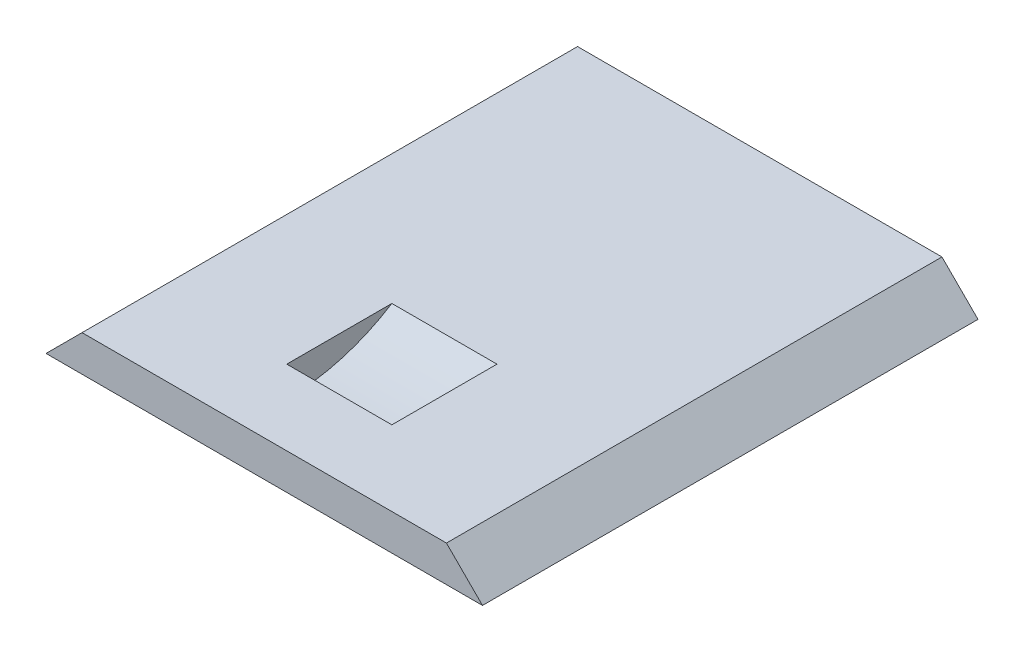
from build123d import *

# Parameters (mm, degrees)
BOSS_EXTRUDE1_DEPTH = 33
SKETCH2_W           = 7
SKETCH2_H           = 7
CUT_EXTRUDE1_DEPTH  = 2
FILLET1_R           = 13


with BuildPart() as part:
    # Sketch1 → Boss-Extrude1 (new body)
    with BuildSketch(Plane.XY):
        Polygon((-12.134314575, 2.8), (-14.534314575, 0.4), (14.534314575, 0.4), (12.134314575, 2.8), align=None)
    extrude(amount=-BOSS_EXTRUDE1_DEPTH)

    # Sketch2 → Cut-Extrude1 (cut)
    with BuildSketch(Plane(origin=(0, 2.8, 0), x_dir=(1, 0, 0), z_dir=(0, 1, 0))):
        with Locations((0, 8.5)):
            Rectangle(SKETCH2_W, SKETCH2_H)
    extrude(amount=-CUT_EXTRUDE1_DEPTH, mode=Mode.SUBTRACT)

    # Fillet1
    # the kernel refuses this fillet: 13 mm, written as the material it adds along each edge
    with BuildSketch(Plane(origin=(-3.5, 0.8, -12), x_dir=(0, 1, 0), z_dir=(1, 0, 0))) as fillet1_piece_1:
        with BuildLine():
            CenterArc((13, 6.92820323), FILLET1_R, 180, 32.204227504)
            Line((0, 6.92820323), (0, 0))
            Line((0, 0), (2, 0))
        make_face()
    extrude(amount=7)


solid = part.part
